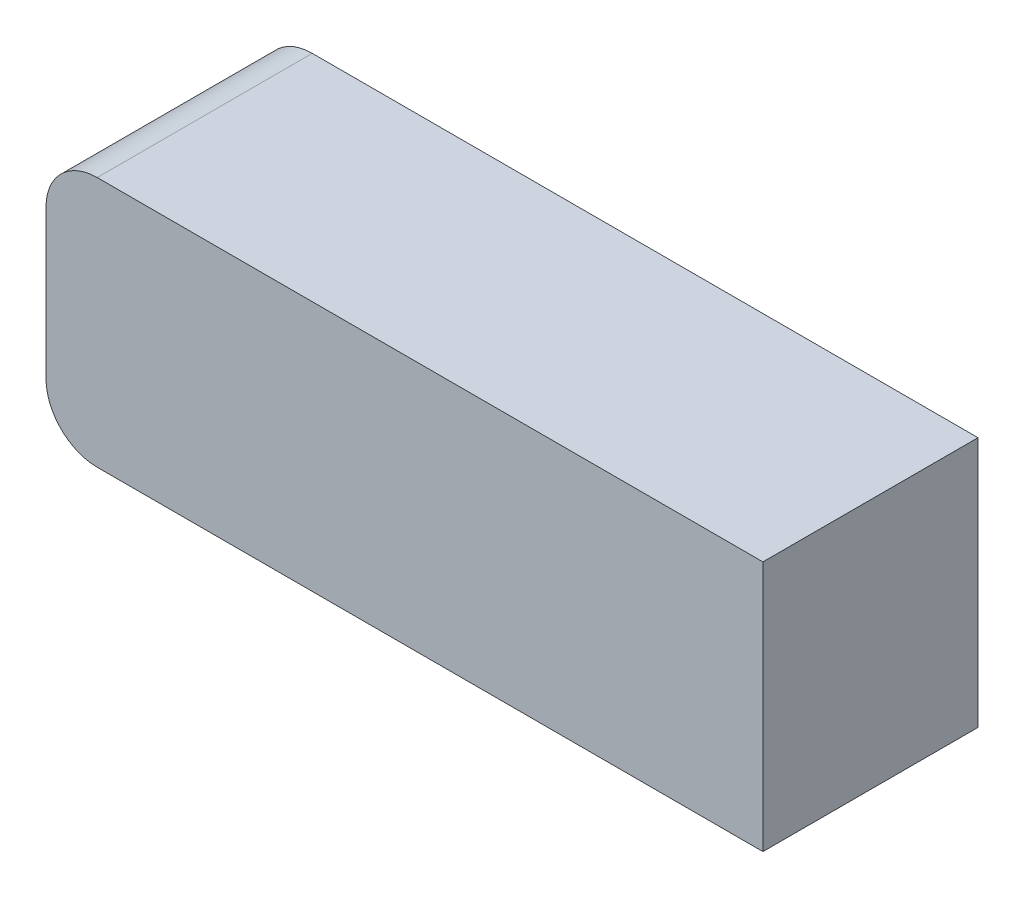
from build123d import *

# Parameters (mm, degrees)
CROQUIS2_W              = 140
CROQUIS2_H              = 42
SALIENTE_EXTRUIR1_DEPTH = 24.5
REDONDEO1_R             = 10


with BuildPart() as part:
    # Croquis2 → Saliente-Extruir1 (new, symmetric)
    with BuildSketch(Plane(origin=(0, 0, 0), x_dir=(1, 0, 0), z_dir=(0, 1, 0))):
        Rectangle(CROQUIS2_W, CROQUIS2_H)
    extrude(amount=SALIENTE_EXTRUIR1_DEPTH, both=True)

    # Redondeo1
    redondeo1_edges = [part.edges().sort_by_distance(p)[0] for p in [
        (-70, -24.5, 0),
        (-70, 24.5, 0),
    ]]
    fillet(redondeo1_edges, radius=REDONDEO1_R)


solid = part.part
